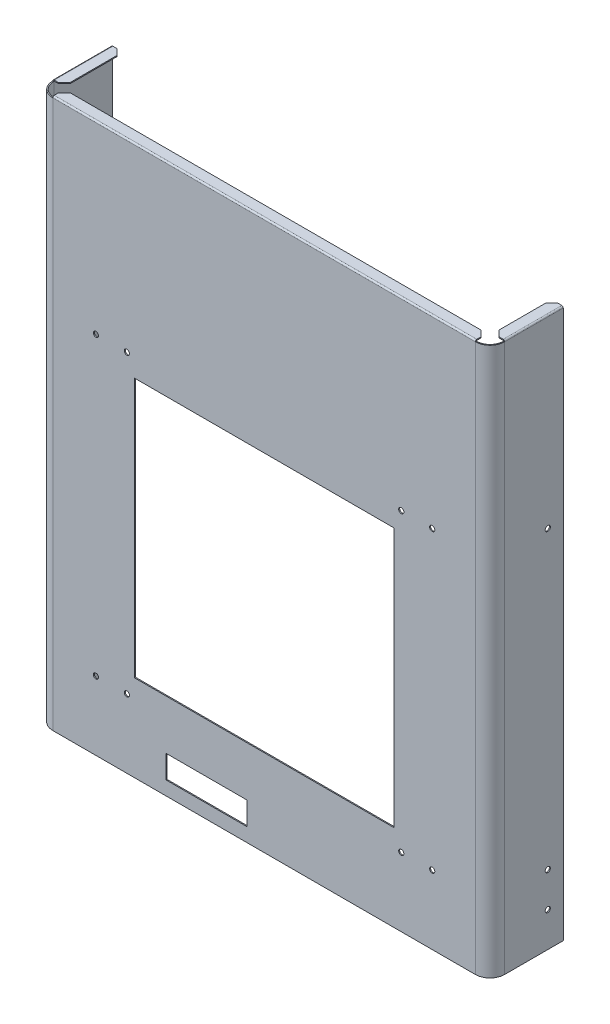
from build123d import *

# Parameters (mm, degrees)
BASE_FLANGE2_DEPTH        = 475
SKETCH6_W                 = 225
SKETCH6_H                 = 225
CUT_EXTRUDE2_DEPTH        = 2.54
SKETCH13_R                = 2.25
CUT_EXTRUDE4_DEPTH        = 619.939427238
SKETCH14_R                = 2.25
CUT_EXTRUDE5_DEPTH        = 0.889
SKETCH15_W                = 70
SKETCH15_H                = 20
CUT_EXTRUDE6_DEPTH        = 0.889
EDGE_FLANGE1_DEPTH        = 50.8
EDGE_FLANGE1_BEND_DEPTH   = 366.299839916
EDGE_FLANGE1_BEND_2_DEPTH = 50.8
BREAK_CORNER1_START       = 475.381
BREAK_CORNER1_DEPTH       = 0.889


# Read off the part's stored shape, not the designer's step: Break-Corner1
# Sheet-metal steps are written as plain solids
with BuildPart() as part:
    # Sketch1 → Base-Flange2 (new body)
    with BuildSketch(Plane(origin=(0, 0, 0), x_dir=(1, 0, 0), z_dir=(0, 1, 0))):
        with BuildLine():
            Line((195.849919958, 63.5), (195.849919958, 12.7))
            ThreePointArc((195.849919958, 12.7), (192.130176079, 3.719743879), (183.149919958, 0))
            Line((183.149919958, 0), (-183.149919958, 0))
            ThreePointArc((-183.149919958, 0), (-192.130176079, 3.719743879), (-195.849919958, 12.7))
            Line((-195.849919958, 12.7), (-195.849919958, 63.5))
            Line((-195.849919958, 63.5), (-194.960919958, 63.5))
            Line((-194.960919958, 63.5), (-194.960919958, 12.7))
            ThreePointArc((-194.960919958, 12.7), (-191.501558151, 4.348361807), (-183.149919958, 0.889))
            Line((-183.149919958, 0.889), (183.149919958, 0.889))
            ThreePointArc((183.149919958, 0.889), (191.501558151, 4.348361807), (194.960919958, 12.7))
            Line((194.960919958, 12.7), (194.960919958, 63.5))
            Line((194.960919958, 63.5), (195.849919958, 63.5))
        make_face()
    extrude(amount=BASE_FLANGE2_DEPTH)

    # Sketch6 → Cut-Extrude2 (cut)
    with BuildSketch(Plane.XY):
        with Locations((0, 187.5)):
            Rectangle(SKETCH6_W, SKETCH6_H)
    extrude(amount=-CUT_EXTRUDE2_DEPTH, mode=Mode.SUBTRACT)

    # Sketch13 → Cut-Extrude4 (cut, through all)
    with BuildSketch(Plane(origin=(195.849919958, 0, 0), x_dir=(0, 0, -1), z_dir=(1, 0, 0))):
        with Locations((50.096107, 60)):
            Circle(SKETCH13_R)
        with Locations((50.096107, 316.132840032)):
            Circle(SKETCH13_R)
        with Locations((50.096107, 30)):
            Circle(SKETCH13_R)
    extrude(amount=-CUT_EXTRUDE4_DEPTH, mode=Mode.SUBTRACT)

    # Sketch14 → Cut-Extrude5 (cut)
    with BuildSketch(Plane.XY):
        with Locations((-145.753813013, 316.132839976)):
            Circle(SKETCH14_R)
        with Locations((-118.946026903, 316.132839976)):
            Circle(SKETCH14_R)
        with Locations((118.946026903, 316.132839976)):
            Circle(SKETCH14_R)
        with Locations((145.753813013, 316.132839976)):
            Circle(SKETCH14_R)
        with Locations((145.753813013, 59.61392)):
            Circle(SKETCH14_R)
        with Locations((118.946026903, 59.61392)):
            Circle(SKETCH14_R)
        with Locations((-118.946026903, 59.61392)):
            Circle(SKETCH14_R)
        with Locations((-145.753813013, 59.61392)):
            Circle(SKETCH14_R)
    extrude(amount=-CUT_EXTRUDE5_DEPTH, mode=Mode.SUBTRACT)

    # Sketch15 → Cut-Extrude6 (cut)
    with BuildSketch(Plane.XY):
        with Locations((-50, 22)):
            Rectangle(SKETCH15_W, SKETCH15_H)
    extrude(amount=-CUT_EXTRUDE6_DEPTH, mode=Mode.SUBTRACT)

    # Edge-Flange1 section (across the edge) → Edge-Flange1 (add)
    with BuildSketch(Plane(origin=(-194.960919958, 475.381, -63.5), x_dir=(0, -1, 0), z_dir=(0, 0, 1))):
        with BuildLine():
            Line((-0.889, 0.381), (-0.889, 9.111))
            Line((-0.889, 9.111), (0, 9.111))
            Line((0, 9.111), (0, 0.381))
            ThreePointArc((0, 0.381), (0.111592316, 0.111592316), (0.381, 0))
            Line((0.381, 0), (0.381, -0.889))
            ThreePointArc((0.381, -0.889), (-0.517025612, -0.517025612), (-0.889, 0.381))
        make_face()
    extrude(amount=EDGE_FLANGE1_DEPTH)

    # Edge-Flange1 section 2 (across the edge) → Edge-Flange1 bend (add)
    with BuildSketch(Plane(origin=(-183.149919958, 475.381, -0.889), x_dir=(0, -1, 0), z_dir=(1, 0, 0))):
        with BuildLine():
            Line((-0.889, 0.381), (-0.889, 9.111))
            Line((-0.889, 9.111), (0, 9.111))
            Line((0, 9.111), (0, 0.381))
            ThreePointArc((0, 0.381), (0.111592316, 0.111592316), (0.381, 0))
            Line((0.381, 0), (0.381, -0.889))
            ThreePointArc((0.381, -0.889), (-0.517025612, -0.517025612), (-0.889, 0.381))
        make_face()
    extrude(amount=EDGE_FLANGE1_BEND_DEPTH)

    # Edge-Flange1 section 3 (across the edge) → Edge-Flange1 bend 2 (add)
    with BuildSketch(Plane(origin=(194.960919958, 475.381, -12.7), x_dir=(0, -1, 0), z_dir=(0, 0, -1))):
        with BuildLine():
            Line((-0.889, 0.381), (-0.889, 9.111))
            Line((-0.889, 9.111), (0, 9.111))
            Line((0, 9.111), (0, 0.381))
            ThreePointArc((0, 0.381), (0.111592316, 0.111592316), (0.381, 0))
            Line((0.381, 0), (0.381, -0.889))
            ThreePointArc((0.381, -0.889), (-0.517025612, -0.517025612), (-0.889, 0.381))
        make_face()
    extrude(amount=EDGE_FLANGE1_BEND_2_DEPTH)

    # Break-Corner1 outline → Break-Corner1 (cut)
    with BuildSketch(Plane(origin=(0, 0, 0), x_dir=(1, 0, 0), z_dir=(0, 1, 0)).offset(BREAK_CORNER1_START)):
        Polygon((183.149919958, 10), (178.149919958, 10), (183.149919958, 5), align=None)
        Polygon((-183.149919958, 5), (-178.149919958, 10), (-183.149919958, 10), align=None)
        Polygon((185.849919958, 63.5), (185.849919958, 58.5), (190.849919958, 63.5), align=None)
        Polygon((190.849919958, 12.7), (185.849919958, 17.7), (185.849919958, 12.7), align=None)
        Polygon((-185.849919958, 12.7), (-185.849919958, 17.7), (-190.849919958, 12.7), align=None)
        Polygon((-190.849919958, 63.5), (-185.849919958, 58.5), (-185.849919958, 63.5), align=None)
    extrude(amount=BREAK_CORNER1_DEPTH, mode=Mode.SUBTRACT)


solid = part.part
